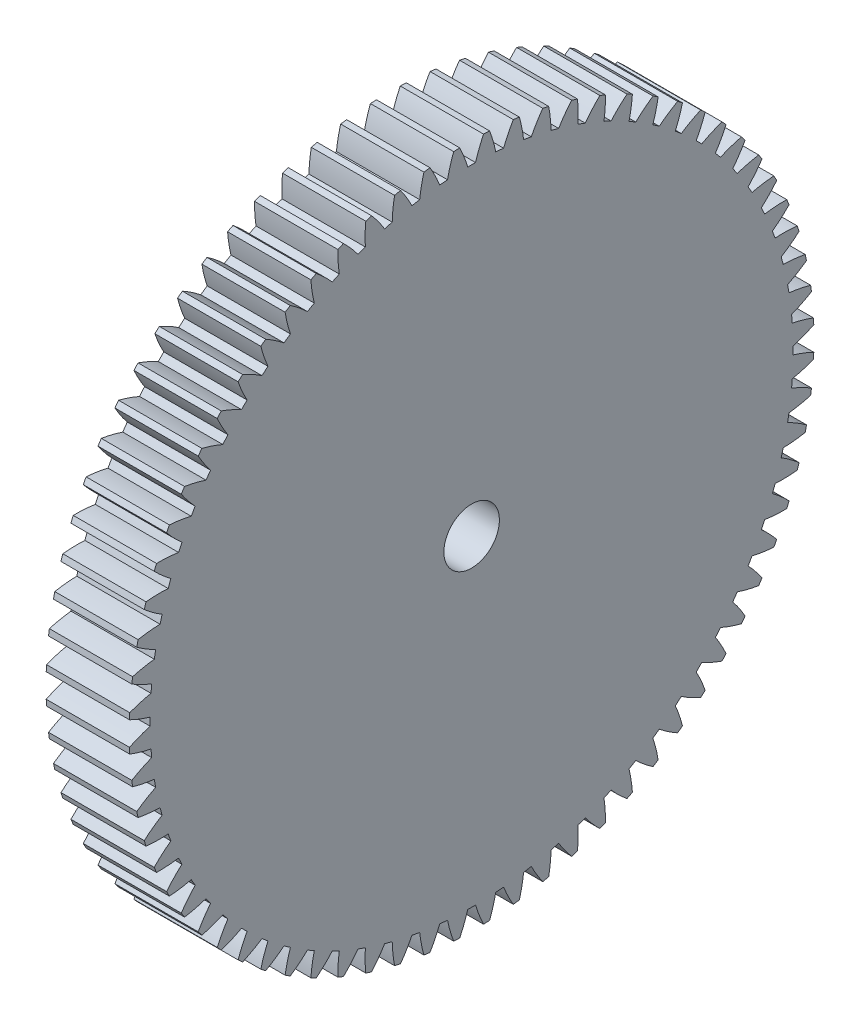
from build123d import *

# Parameters (mm, degrees)
BASPROSKE_W             = 9
BASPROSKE_H             = 37
TOOTHCUT_DEPTH          = 54.09425581
TEETHCUTS_COUNT         = 72
TEETHCUTS_ANGLE         = 355
HUBNEAONESKE_R          = 10.5
HUBNEARONE_DEPTH        = 9.0000508
BORSKE_R                = 3
BORE_DEPTH              = 18.0000508
CUT_EXTRUDE1_START      = -2.2
SKETCH1_R               = 33
SKETCH1_R_2             = 10.5
CUT_EXTRUDE1_DEPTH      = 2.2
CUT_EXTRUDE3_DEPTH      = 54.063076309
CUT_EXTRUDE3_DEPTH_BACK = 54.063076309
SKETCH2_W               = 4.5000508
SKETCH2_H               = 21
CUT_EXTRUDE5_REACH      = 55.063
SKETCH4_R               = 1.35


with BuildPart() as part:
    # BasProSke → Base-Revolve (revolve)
    with BuildSketch(Plane(origin=(0, 0, 0), x_dir=(1, 0, 0), z_dir=(0, 1, 0))):
        with Locations((4.5, 18.5)):
            Rectangle(BASPROSKE_W, BASPROSKE_H)
    revolve(axis=Axis((-10, 0, 0), (1, 0, 0)))

    # TooCutSke → ToothCut (cut, through all)
    with BuildSketch(Plane(origin=(0, 0, 0), x_dir=(0, 0, -1), z_dir=(1, 0, 0))):
        with BuildLine():
            ThreePointArc((0.423780778, 34.746415799), (0, 34.749), (-0.423780778, 34.746415799))
            ThreePointArc((-0.423780778, 34.746415799), (-0.813812371, 35.892927914), (-1.298800936, 37.002612898))
            ThreePointArc((-1.298800936, 37.002612898), (0, 37.0254), (1.298800936, 37.002612898))
            ThreePointArc((1.298800936, 37.002612898), (0.813812371, 35.892927914), (0.423780778, 34.746415799))
        make_face()
    toothcut = extrude(amount=TOOTHCUT_DEPTH, mode=Mode.SUBTRACT)

    # TeethCuts: ToothCut ×72 about axis
    teethcuts_axis = Axis((-10, 0, 0), (1, 0, 0))
    for i in range(1, TEETHCUTS_COUNT):
        add(toothcut.rotate(teethcuts_axis, i * TEETHCUTS_ANGLE / (TEETHCUTS_COUNT - 1)), mode=Mode.SUBTRACT)

    # HubNeaOneSke → HubNearOne (add)
    with BuildSketch(Plane.ZY):
        Circle(HUBNEAONESKE_R)
    extrude(amount=HUBNEARONE_DEPTH)

    # BorSke → Bore (cut, symmetric)
    with BuildSketch(Plane(origin=(0, 0, 0), x_dir=(0, 0, -1), z_dir=(1, 0, 0))):
        Circle(BORSKE_R)
    extrude(amount=BORE_DEPTH, both=True, mode=Mode.SUBTRACT)

    # Sketch1 → Cut-Extrude1 (cut)
    with BuildSketch(Plane.ZY.offset(CUT_EXTRUDE1_START)):
        Circle(SKETCH1_R)
        Circle(SKETCH1_R_2, mode=Mode.SUBTRACT)
    extrude(amount=CUT_EXTRUDE1_DEPTH, mode=Mode.SUBTRACT)

    # Sketch2 → Cut-Extrude3 (cut, two sides: drawn at the far end of the back side and taken through both)
    with BuildSketch(Plane(origin=(0, 0, 0), x_dir=(1, 0, 0), z_dir=(0, 1, 0)).offset(-CUT_EXTRUDE3_DEPTH_BACK)):
        with Locations((-6.7500254, 0)):
            Rectangle(SKETCH2_W, SKETCH2_H)
    extrude(amount=CUT_EXTRUDE3_DEPTH + CUT_EXTRUDE3_DEPTH_BACK, mode=Mode.SUBTRACT)

    # Sketch4 → Cut-Extrude5 (cut, up to next)
    with BuildSketch(Plane(origin=(0, 0, 0), x_dir=(1, 0, 0), z_dir=(0, 1, 0)), mode=Mode.PRIVATE) as cut_extrude5_sk1:
        with Locations((-1.4, 0)):
            Circle(SKETCH4_R)
    cut_extrude5_tool1 = extrude(cut_extrude5_sk1.sketch, amount=-CUT_EXTRUDE5_REACH, mode=Mode.PRIVATE) & part.part
    add(cut_extrude5_tool1.solids().sort_by_distance((-1.4, 0, 0))[0], mode=Mode.SUBTRACT)


solid = part.part
